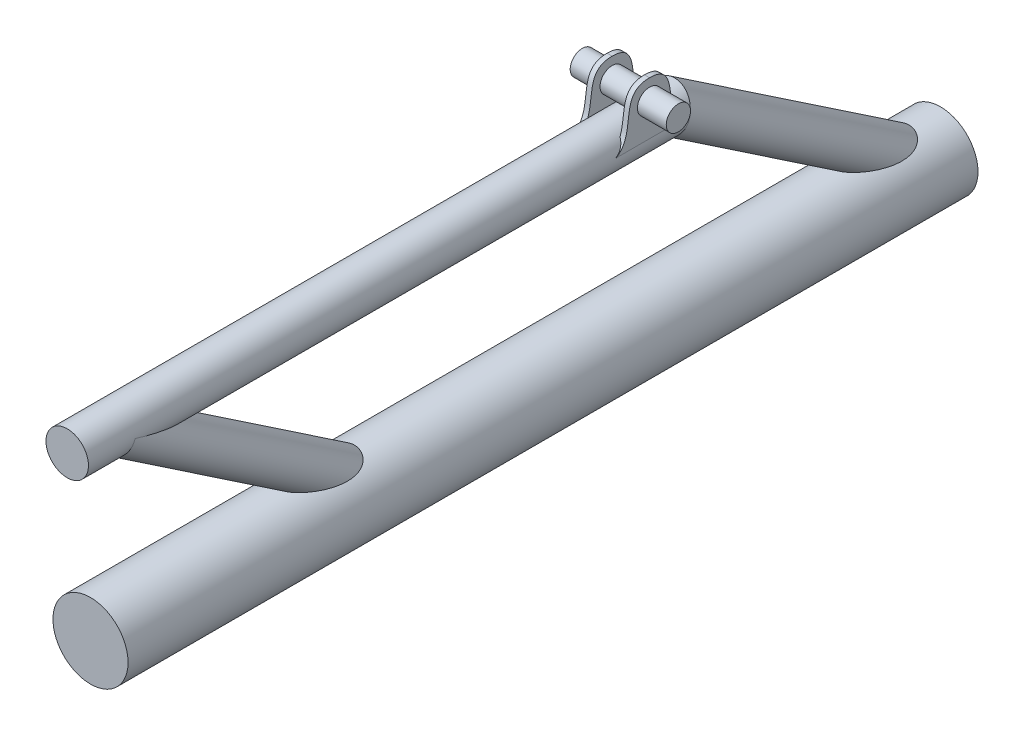
from build123d import *

# Parameters (mm, degrees)
SKETCH1_R                = 25.8
BOSS_EXTRUDE1_DEPTH      = 544
SKETCH6_R                = 14.6
BOSS_EXTRUDE2_REACH      = 541.822
BOSS_EXTRUDE2_END_RADIUS = 25.8
SKETCH4_R                = 14.6
BOSS_EXTRUDE3_START      = -3.5
BOSS_EXTRUDE3_OUTLINE_R  = 8.35
BOSS_EXTRUDE3_DEPTH      = 3.5
BOSS_EXTRUDE4_START      = 17
SKETCH7_3_R              = 8.35
BOSS_EXTRUDE4_DEPTH      = 66
SKETCH9_R                = 25.8
BOSS_EXTRUDE5_DEPTH      = 16.49
BOSS_EXTRUDE6_START      = 23.51
SKETCH10_R               = 25.8
BOSS_EXTRUDE6_DEPTH      = 23.51
BOSS_EXTRUDE7_START      = 13
SKETCH11_R               = 14.6
BOSS_EXTRUDE7_DEPTH      = 13


# Read off the part's stored shape, not the designer's step: Boss-Extrude3
with BuildPart() as part:
    # Sketch1 → Boss-Extrude1 (new body)
    with BuildSketch(Plane.XY):
        Circle(SKETCH1_R)
    extrude(amount=-BOSS_EXTRUDE1_DEPTH)

    # Sweep2: sweep along a path in Sketch2
    with BuildLine(Plane(origin=(0, 0, 0), x_dir=(0, 0, -1), z_dir=(1, 0, 0))) as sweep2_path:
        Line((535.242725219, 10.616416132), (373.485286901, 119.6))
        Line((373.485286901, 119.6), (-26.514713099, 119.6))
    # Sketch6 → Sweep2 (sweep)
    with BuildSketch(Plane(origin=(0, 10.616416132, -535.242725219), x_dir=(1, 0, 0), z_dir=(0, 0.5587587437797145, 0.8293302516185669))):
        Circle(SKETCH6_R)
    sweep(path=sweep2_path.line, transition=Transition.RIGHT)

    # Boss-Extrude2: up to this cylinder (the profile starts outside it)
    boss_extrude2_end = Plane(origin=(0, 0, 7.489761), z_dir=(0, 0, 1)) * Cylinder(BOSS_EXTRUDE2_END_RADIUS, 1136.244, mode=Mode.PRIVATE)
    # Sketch4 → Boss-Extrude2 (add, up to the surface)
    with BuildSketch(Plane(origin=(0, 296.142134203, -111.454966642), x_dir=(1, 0, 0), z_dir=(0, 0.5587587437797145, 0.8293302516185669)), mode=Mode.PRIVATE) as boss_extrude2_sk1:
        with Locations(Location((0, -212.87313933, 0), (0, 0, 270))):
            Circle(SKETCH4_R)
    boss_extrude2_tool1 = extrude(boss_extrude2_sk1.sketch, amount=-BOSS_EXTRUDE2_REACH, mode=Mode.PRIVATE) - boss_extrude2_end
    add(boss_extrude2_tool1.solids().sort_by_distance((0, 119.6, 7.489761))[0])

    # Boss-Extrude3 outline → Boss-Extrude3 (add)
    with BuildSketch(Plane.ZY.offset(14.6).offset(BOSS_EXTRUDE3_START)):
        with BuildLine():
            add(Edge.make_bspline(
                [(-369.025798161, 121.314868638), (-354.153662916, 130.263805611), (-368.24558028, 157.483504956), (-346.0257981, 157.599948143)],
                knots=[0, 0, 0, 0, 0.999846057, 0.999846057, 0.999846057, 0.999846057], degree=3))
            Line((-369.025798161, 121.314868638), (-323.025798161, 121.314868638))
            add(Edge.make_bspline(
                [(-323.025798161, 121.314868638), (-337.897933379, 130.263805595), (-323.806016093, 157.483504857), (-346.0257981, 157.599948143)],
                knots=[0, 0, 0, 0, 0.999846056, 0.999846056, 0.999846056, 0.999846056], degree=3))
        make_face()
        with Locations((-346.025798161, 143.65)):
            Circle(BOSS_EXTRUDE3_OUTLINE_R, mode=Mode.SUBTRACT)
    boss_extrude3 = extrude(amount=BOSS_EXTRUDE3_DEPTH)

    # Mirror1: Boss-Extrude3 across plane
    add(boss_extrude3.mirror(Plane.ZY))

    # Sketch7<3> → Boss-Extrude4 (add)
    with BuildSketch(Plane.ZY.offset(14.6).offset(BOSS_EXTRUDE4_START)):
        with Locations((-346.025798161, 143.65)):
            Circle(SKETCH7_3_R)
    extrude(amount=-BOSS_EXTRUDE4_DEPTH)

    # Sketch9 → Boss-Extrude5 (add)
    with BuildSketch(Plane(origin=(0, 0, -544), x_dir=(-1, 0, 0), z_dir=(0, 0, -1))):
        with Locations(Location((0, 0, 0), (0, 0, 180))):
            Circle(SKETCH9_R)
    extrude(amount=BOSS_EXTRUDE5_DEPTH)

    # Sketch10 → Boss-Extrude6 (add)
    with BuildSketch(Plane.XY.offset(BOSS_EXTRUDE6_START)):
        Circle(SKETCH10_R)
    extrude(amount=-BOSS_EXTRUDE6_DEPTH)

    # Sketch11 → Boss-Extrude7 (add)
    with BuildSketch(Plane.XY.offset(26.514713099).offset(BOSS_EXTRUDE7_START)):
        with Locations((0, 119.6)):
            Circle(SKETCH11_R)
    extrude(amount=-BOSS_EXTRUDE7_DEPTH)


solid = part.part
